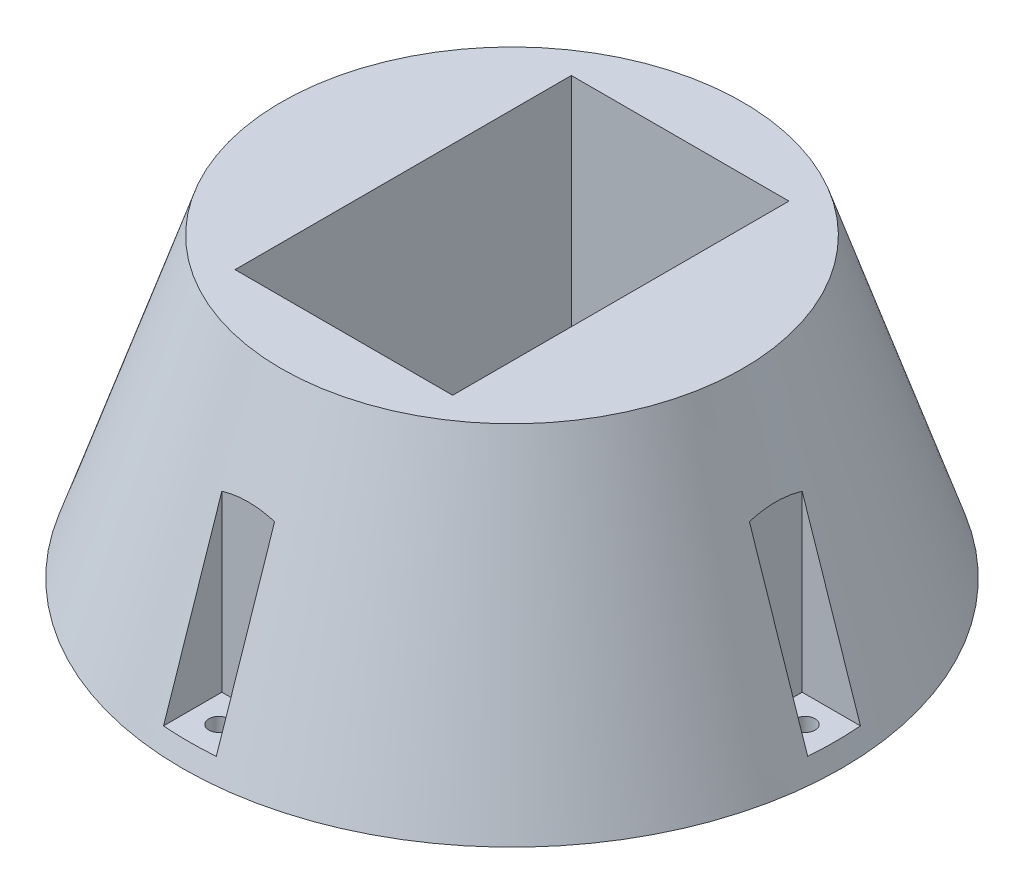
from build123d import *

# Parameters (mm, degrees)
ESQUISSE2_W                  = 33
ESQUISSE2_H                  = 51
ENL_V_MAT_EXTRU_1_DEPTH      = 41
ESQUISSE3_W                  = 8
ESQUISSE3_H                  = 12
ESQUISSE3_W_2                = 12
ESQUISSE3_H_2                = 8
ENL_V_MAT_EXTRU_3_DEPTH      = 42
ESQUISSE4_W                  = 23.524420498
ESQUISSE4_H                  = 14.572913479
ENL_V_MAT_EXTRU_4_DEPTH      = 269
ESQUISSE6_R                  = 1.5
ENL_V_MAT_EXTRU_5_DEPTH      = 10
R_P_TITION_CIRCULAIRE1_COUNT = 4


with BuildPart() as part:
    # Esquisse1 → Révolution1 (revolve)
    with BuildSketch(Plane.XY):
        Polygon((0, 0), (-50, 0), (-35, 45), (0, 45), align=None)
    revolve(axis=Axis((0, 185.624886126, 0), (0, -1, 0)))

    # Esquisse2 → Enlèv. mat.-Extru.1 (cut)
    with BuildSketch(Plane(origin=(0, 45, 0), x_dir=(1, 0, 0), z_dir=(0, 1, 0))):
        Rectangle(ESQUISSE2_W, ESQUISSE2_H)
    extrude(amount=-ENL_V_MAT_EXTRU_1_DEPTH, mode=Mode.SUBTRACT)

    # Esquisse3 → Enlèv. mat.-Extru.3 (cut)
    with BuildSketch(Plane(origin=(0, 45, 0), x_dir=(1, 0, 0), z_dir=(0, 1, 0))):
        with Locations((0, 46)):
            Rectangle(ESQUISSE3_W, ESQUISSE3_H)
        with Locations((46, 0)):
            Rectangle(ESQUISSE3_W_2, ESQUISSE3_H_2)
        with Locations((0, -46)):
            Rectangle(ESQUISSE3_W, ESQUISSE3_H)
        with Locations((-46, 0)):
            Rectangle(ESQUISSE3_W_2, ESQUISSE3_H_2)
    extrude(amount=-ENL_V_MAT_EXTRU_3_DEPTH, mode=Mode.SUBTRACT)

    # Esquisse4 → Enlèv. mat.-Extru.4 (cut)
    with BuildSketch(Plane(origin=(0, 4, 0), x_dir=(1, 0, 0), z_dir=(0, 1, 0))):
        with Locations((-1.026102351, -0.627863405)):
            Rectangle(ESQUISSE4_W, ESQUISSE4_H)
    extrude(amount=-ENL_V_MAT_EXTRU_4_DEPTH, mode=Mode.SUBTRACT)

    # Esquisse6 → Enlèv. mat.-Extru.5 (cut)
    with BuildSketch(Plane(origin=(0, 3, 0), x_dir=(1, 0, 0), z_dir=(0, 1, 0))):
        with Locations((0, 44.460655409)):
            Circle(ESQUISSE6_R)
    enl_v_mat_extru_5 = extrude(amount=-ENL_V_MAT_EXTRU_5_DEPTH, mode=Mode.SUBTRACT)

    # Répétition circulaire1: Enlèv. mat.-Extru.5 ×4 about axis
    r_p_tition_circulaire1_axis = Axis((0, 45, 0), (0, 1, 0))
    for i in range(1, R_P_TITION_CIRCULAIRE1_COUNT):
        add(enl_v_mat_extru_5.rotate(r_p_tition_circulaire1_axis, i * 360 / R_P_TITION_CIRCULAIRE1_COUNT), mode=Mode.SUBTRACT)


solid = part.part
